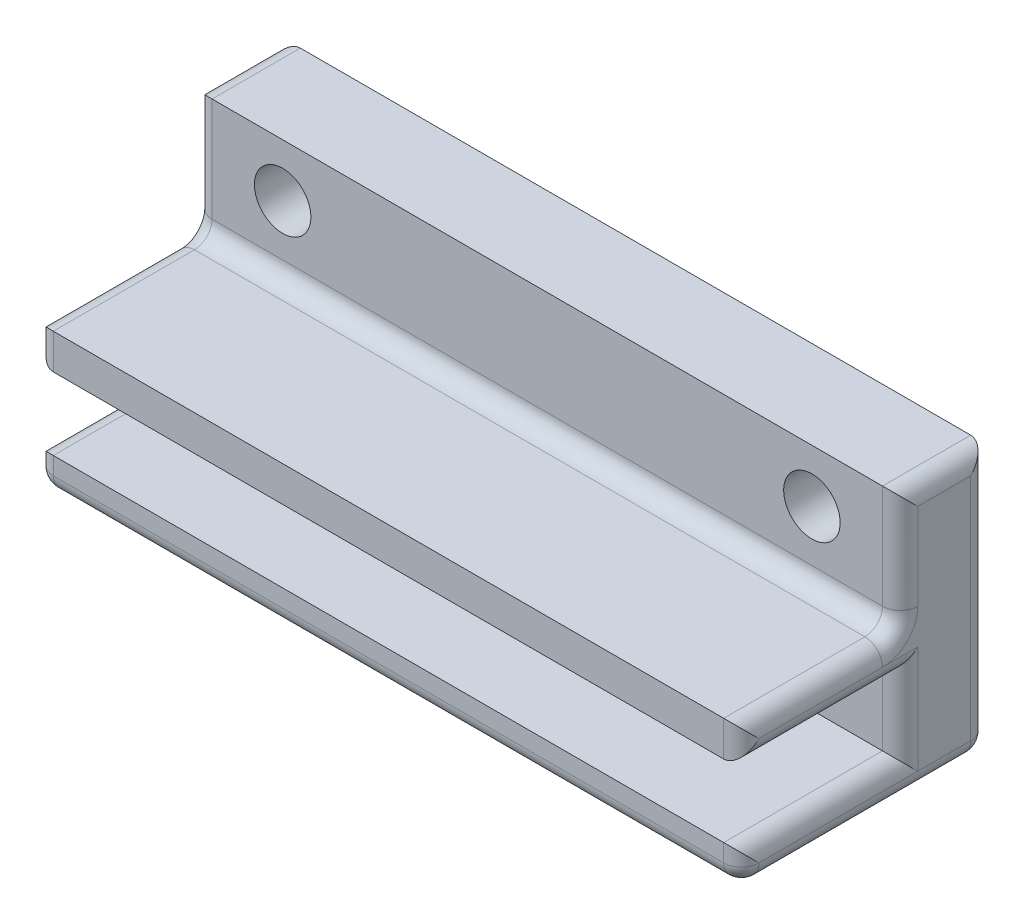
from build123d import *

# Parameters (mm, degrees)
SKETCH2_W           = 40
SKETCH2_H           = 6.9
SKETCH2_R           = 1.6
SKETCH2_H_2         = 2
SKETCH2_H_3         = 4.1
BOSS_EXTRUDE1_DEPTH = 5
SKETCH2_3_W         = 40
SKETCH2_3_H         = 2
BOSS_EXTRUDE2_DEPTH = 14
FILLET1_R           = 1


with BuildPart() as part:
    # Sketch2 → Boss-Extrude1 (new body)
    # profile 1 of 4: a face of its own
    with BuildSketch(Plane.XY):
        with Locations((0, 4.05)):
            Rectangle(SKETCH2_W, SKETCH2_H)
        with Locations((-15, 4.5)):
            Circle(SKETCH2_R, mode=Mode.SUBTRACT)
        with Locations((15, 4.5)):
            Circle(SKETCH2_R, mode=Mode.SUBTRACT)
    # profile 2 of 4: a face of its own
    with BuildSketch(Plane.XY):
        with Locations((0, -0.4)):
            Rectangle(SKETCH2_W, SKETCH2_H_2)
    # profile 3 of 4: a face of its own
    with BuildSketch(Plane.XY):
        with Locations((0, -3.45)):
            Rectangle(SKETCH2_W, SKETCH2_H_3)
    # profile 4 of 4: a face of its own
    with BuildSketch(Plane.XY):
        with Locations((0, -6.5)):
            Rectangle(SKETCH2_W, SKETCH2_H_2)
    extrude(amount=BOSS_EXTRUDE1_DEPTH)

    # Sketch2<3> → Boss-Extrude2 (add)
    with BuildSketch(Plane.XY):
        with Locations((0, -0.4)):
            Rectangle(SKETCH2_3_W, SKETCH2_3_H)
        with Locations((0, -6.5)):
            Rectangle(SKETCH2_3_W, SKETCH2_3_H)
    extrude(amount=BOSS_EXTRUDE2_DEPTH)

    # Fillet1
    fillet1_edges = [part.edges().sort_by_distance(p)[0] for p in [
        (20, 0, 0),
        (0, -7.5, 0),
        (-20, 0, 0),
        (-20, 7.5, 2.5),
        (20, 7.5, 2.5),
        (20, -7.5, 7),
        (-20, -7.5, 7),
        (-20, 4.05, 5),
        (20, 4.05, 5),
        (-20, 0.6, 9.5),
        (-20, -0.4, 14),
        (-20, -1.4, 9.5),
        (20, -1.4, 9.5),
        (20, 0.6, 9.5),
        (0, 0.6, 5),
        (20, -0.4, 14),
        (20, -3.45, 5),
        (-20, -3.45, 5),
        (20, -5.5, 9.5),
        (-20, -5.5, 9.5),
        (-20, -6.5, 14),
        (0, -7.5, 14),
        (20, -6.5, 14),
    ]]
    fillet(fillet1_edges, radius=FILLET1_R - 0.0001)  # a hair under: the kernel refuses the full size


solid = part.part
